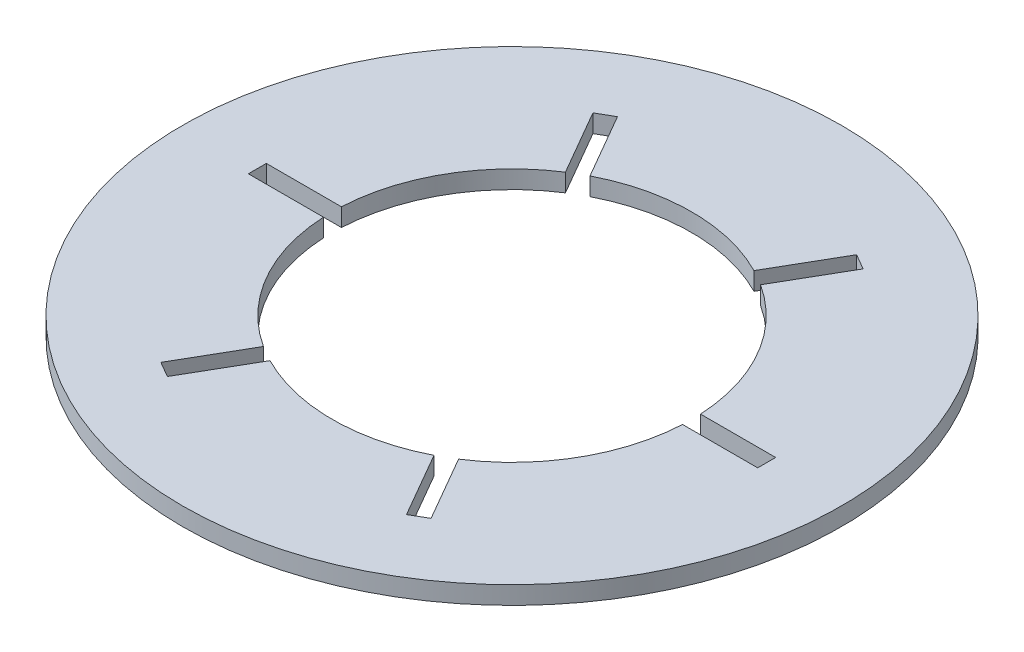
from build123d import *

# Parameters (mm, degrees)
SKETCH1_R           = 55
BOSS_EXTRUDE1_DEPTH = 3
SKETCH2_R           = 30
CUT_EXTRUDE1_DEPTH  = 3
SKETCH3_W           = 25
SKETCH3_H           = 3
CUT_EXTRUDE2_DEPTH  = 3
CIRPATTERN1_COUNT   = 6


with BuildPart() as part:
    # Sketch1 → Boss-Extrude1 (new body)
    with BuildSketch(Plane(origin=(0, 0, 0), x_dir=(1, 0, 0), z_dir=(0, 1, 0))):
        Circle(SKETCH1_R)
    extrude(amount=BOSS_EXTRUDE1_DEPTH)

    # Sketch2 → Cut-Extrude1 (cut)
    with BuildSketch(Plane(origin=(0, 3, 0), x_dir=(1, 0, 0), z_dir=(0, 1, 0))):
        Circle(SKETCH2_R)
    extrude(amount=-CUT_EXTRUDE1_DEPTH, mode=Mode.SUBTRACT)

    # Sketch3 → Cut-Extrude2 (cut)
    with BuildSketch(Plane(origin=(0, 3, 0), x_dir=(1, 0, 0), z_dir=(0, 1, 0))):
        with Locations((-30, 0)):
            Rectangle(SKETCH3_W, SKETCH3_H)
    cut_extrude2 = extrude(amount=-CUT_EXTRUDE2_DEPTH, mode=Mode.SUBTRACT)

    # CirPattern1: Cut-Extrude2 ×6 about axis
    cirpattern1_axis = Axis((0, 3, 0), (0, 1, 0))
    for i in range(1, CIRPATTERN1_COUNT):
        add(cut_extrude2.rotate(cirpattern1_axis, i * 360 / CIRPATTERN1_COUNT), mode=Mode.SUBTRACT)


solid = part.part
